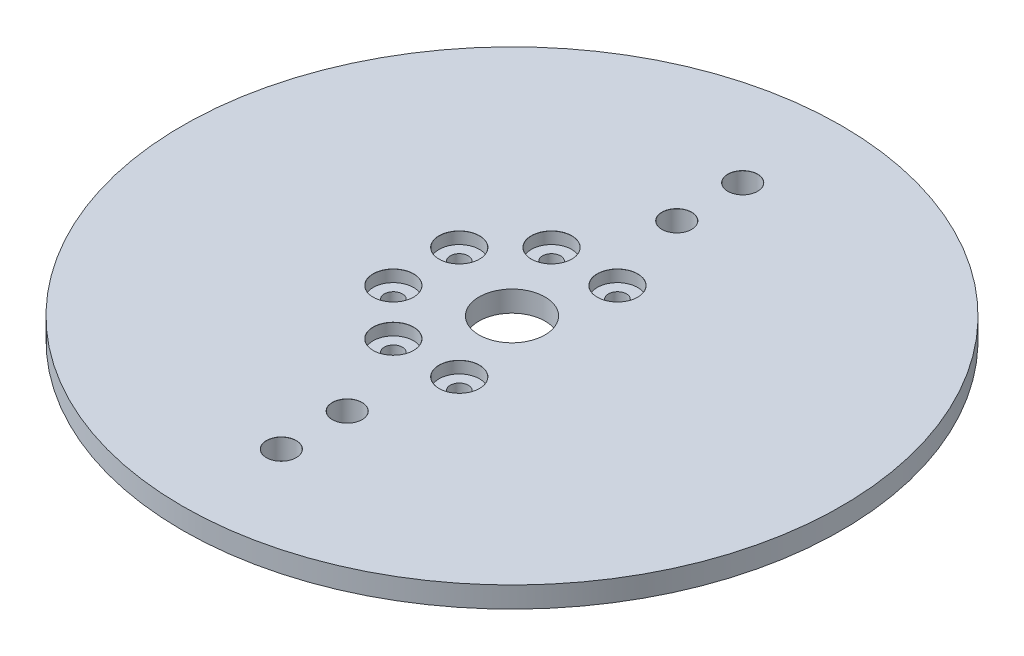
from build123d import *

# Parameters (mm, degrees)
SKETCH1_R                              = 100
BOSS_EXTRUDE1_DEPTH                    = 6.35
SKETCH2_R                              = 10
CUT_EXTRUDE1_DEPTH                     = 142.56384602
M8_CLEARANCE_HOLE1_D                   = 9
M8_CLEARANCE_HOLE1_CSINK_D             = 9.05
M8_CLEARANCE_HOLE1_CSINK_ANGLE         = 90
CBORE_FOR_M5_HEX_HEAD_BOLT1_AT_2_COUNT = 2
CBORE_FOR_M5_HEX_HEAD_BOLT1_AT_2_PITCH = 19.798989873
CBORE_FOR_M5_HEX_HEAD_BOLT1_AT_3_COUNT = 2
CBORE_FOR_M5_HEX_HEAD_BOLT1_AT_3_PITCH = 36.769552622
CBORE_FOR_M5_HEX_HEAD_BOLT1_AT_4_COUNT = 2
CBORE_FOR_M5_HEX_HEAD_BOLT1_AT_4_PITCH = 20
CBORE_FOR_M5_HEX_HEAD_BOLT1_AT_5_COUNT = 2
CBORE_FOR_M5_HEX_HEAD_BOLT1_AT_5_PITCH = 36.769552622
CBORE_FOR_M5_HEX_HEAD_BOLT1_AT_6_COUNT = 2
CBORE_FOR_M5_HEX_HEAD_BOLT1_AT_6_PITCH = 48.083261121


with BuildPart() as part:
    # Sketch1 → Boss-Extrude1 (new body)
    with BuildSketch(Plane(origin=(0, 0, 0), x_dir=(1, 0, 0), z_dir=(0, 1, 0))):
        Circle(SKETCH1_R)
    extrude(amount=BOSS_EXTRUDE1_DEPTH)

    # Sketch2 → Cut-Extrude1 (cut, through all)
    with BuildSketch(Plane(origin=(0, 6.35, 0), x_dir=(1, 0, 0), z_dir=(0, 1, 0))):
        Circle(SKETCH2_R)
    extrude(amount=-CUT_EXTRUDE1_DEPTH, mode=Mode.SUBTRACT)

    # M8 Clearance Hole1 (through all)
    with Locations(Plane(origin=(0, 6.35, 0), x_dir=(1, 0, 0), z_dir=(0, 1, 0))):
        with Locations((0, 70), (0, 50), (0, -50), (0, -70)):
            CounterSinkHole(M8_CLEARANCE_HOLE1_D / 2, M8_CLEARANCE_HOLE1_CSINK_D / 2, counter_sink_angle=M8_CLEARANCE_HOLE1_CSINK_ANGLE)

    # Sketch8 → CBORE for M5 Hex Head Bolt1 (revolve, cut)
    with BuildSketch(Plane(origin=(-26, 6.35, -10), x_dir=(0, 0, 1), z_dir=(1, 0, 0))):
        Polygon((0, 0), (0, 6.35), (2.75, 6.35), (2.75, 3.58), (6.12, 3.58), (6.12, 0.025), (6.145, 0), align=None)
    cbore_for_m5_hex_head_bolt1 = revolve(axis=Axis((-26, 12.7, -10), (0, -1, 0)), mode=Mode.SUBTRACT)

    # CBORE for M5 Hex Head Bolt1 at 2: CBORE for M5 Hex Head Bolt1 ×2
    with Locations(*[Vector(0.7071067811865476, 0, -0.7071067811865476) * (i * CBORE_FOR_M5_HEX_HEAD_BOLT1_AT_2_PITCH) for i in range(1, CBORE_FOR_M5_HEX_HEAD_BOLT1_AT_2_COUNT)]):
        add(cbore_for_m5_hex_head_bolt1, mode=Mode.SUBTRACT)

    # CBORE for M5 Hex Head Bolt1 at 3: CBORE for M5 Hex Head Bolt1 ×2
    with Locations(*[Vector(0.924678098474716, 0, -0.38074980525429486) * (i * CBORE_FOR_M5_HEX_HEAD_BOLT1_AT_3_PITCH) for i in range(1, CBORE_FOR_M5_HEX_HEAD_BOLT1_AT_3_COUNT)]):
        add(cbore_for_m5_hex_head_bolt1, mode=Mode.SUBTRACT)

    # CBORE for M5 Hex Head Bolt1 at 4: CBORE for M5 Hex Head Bolt1 ×2
    with Locations(*[(0, 0, i * CBORE_FOR_M5_HEX_HEAD_BOLT1_AT_4_PITCH) for i in range(1, CBORE_FOR_M5_HEX_HEAD_BOLT1_AT_4_COUNT)]):
        add(cbore_for_m5_hex_head_bolt1, mode=Mode.SUBTRACT)

    # CBORE for M5 Hex Head Bolt1 at 5: CBORE for M5 Hex Head Bolt1 ×2
    with Locations(*[Vector(0.38074980525429486, 0, 0.924678098474716) * (i * CBORE_FOR_M5_HEX_HEAD_BOLT1_AT_5_PITCH) for i in range(1, CBORE_FOR_M5_HEX_HEAD_BOLT1_AT_5_COUNT)]):
        add(cbore_for_m5_hex_head_bolt1, mode=Mode.SUBTRACT)

    # CBORE for M5 Hex Head Bolt1 at 6: CBORE for M5 Hex Head Bolt1 ×2
    with Locations(*[Vector(0.7071067811865476, 0, 0.7071067811865476) * (i * CBORE_FOR_M5_HEX_HEAD_BOLT1_AT_6_PITCH) for i in range(1, CBORE_FOR_M5_HEX_HEAD_BOLT1_AT_6_COUNT)]):
        add(cbore_for_m5_hex_head_bolt1, mode=Mode.SUBTRACT)


solid = part.part
